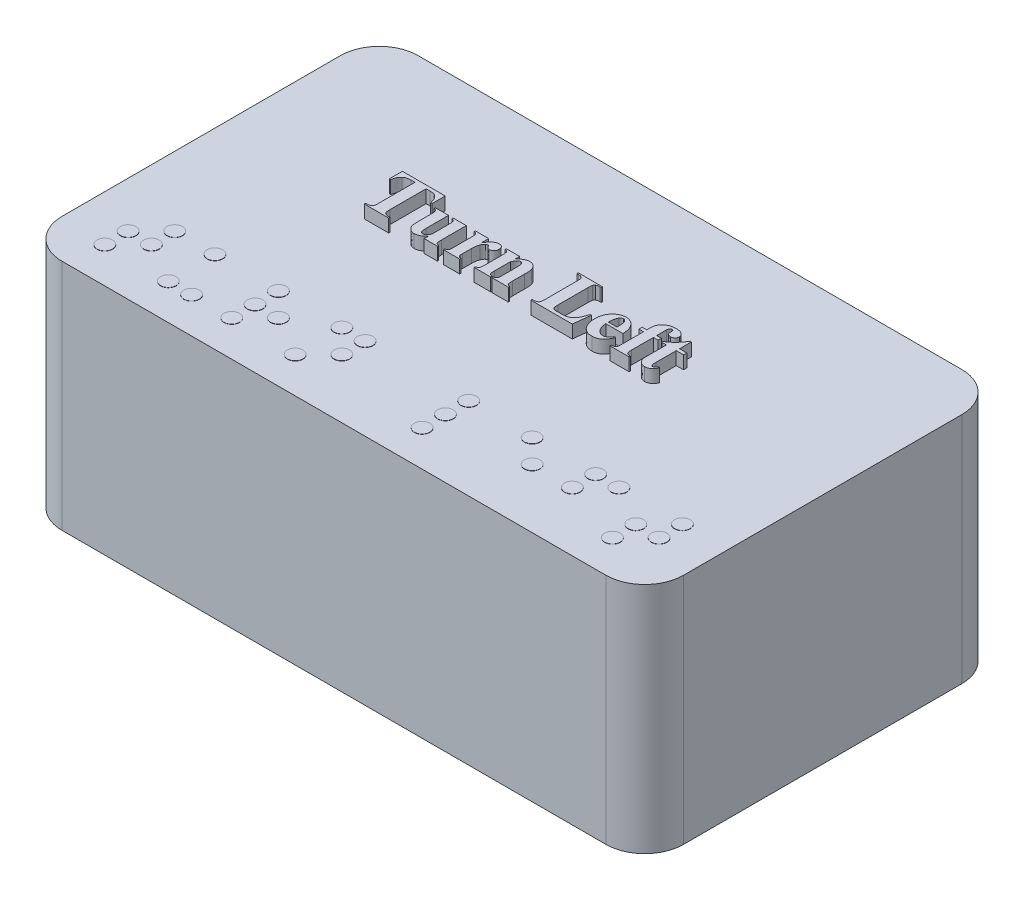
from build123d import *

# Parameters (mm, degrees)
SKETCH1_W           = 60.96
SKETCH1_H           = 34.925
BOSS_EXTRUDE1_DEPTH = 22.86
BOSS_EXTRUDE3_DEPTH = 1.27
SKETCH3_R           = 0.762
BOSS_EXTRUDE4_DEPTH = 0.0254
SKETCH6_R           = 3.1499937
CUT_EXTRUDE1_DEPTH  = 3.25
SKETCH7_W           = 41.656
SKETCH7_H           = 22.86
CUT_EXTRUDE2_DEPTH  = 17.78
FILLET2_R           = 3.81
SKETCH8_W           = 8.128
SKETCH8_H           = 8.128
BOSS_EXTRUDE5_DEPTH = 13.97


with BuildPart() as part:
    # Sketch1 → Boss-Extrude1 (new body)
    with BuildSketch(Plane(origin=(0, 0, 0), x_dir=(1, 0, 0), z_dir=(0, 1, 0))):
        Rectangle(SKETCH1_W, SKETCH1_H)
    extrude(amount=BOSS_EXTRUDE1_DEPTH)

    # Sketch2 → Boss-Extrude3 (add)
    # profile 1 of 8: a face of its own
    with BuildSketch(Plane(origin=(0, 22.86, 0), x_dir=(1, 0, 0), z_dir=(0, 1, 0))):
        with BuildLine():
            Line((-12.148455524, 5.599933811), (-12.148455524, 4.308979974))
            Line((-12.148455524, 4.308979974), (-12.277550908, 4.308979974))
            add(Edge.make_bspline(
                [(-12.277550908, 4.308979974), (-12.294909334, 4.375100646), (-12.327334265, 4.498611739), (-12.384039289, 4.667143435), (-12.443870984, 4.806085238), (-12.508893714, 4.918547094), (-12.582321069, 5.010972582), (-12.666276071, 5.090032176), (-12.761353721, 5.160732409), (-12.832360072, 5.197787672), (-12.868565711, 5.216681891)],
                knots=[0, 0, 0, 0, 1.457214957, 2.722026344, 3.787486567, 4.677495633, 5.483472642, 6.294659805, 7.130459019, 8, 8, 8, 8], degree=3))
            add(Edge.make_bspline(
                [(-12.868565711, 5.216681891), (-12.893225428, 5.226172848), (-12.949269887, 5.24774307), (-13.049194913, 5.264469029), (-13.171879924, 5.27520717), (-13.261528456, 5.276494697), (-13.310313977, 5.277195352)],
                knots=[0, 0, 0, 0, 0.705326227, 1.603004102, 2.695587181, 4, 4, 4, 4], degree=3))
            Line((-13.310313977, 5.277195352), (-13.697600128, 5.277195352))
            Line((-13.697600128, 5.277195352), (-13.697600128, 1.727072302))
            add(Edge.make_bspline(
                [(-13.697600128, 1.727072302), (-13.697226832, 1.699841593), (-13.696512494, 1.647733072), (-13.696077108, 1.573745709), (-13.693314113, 1.507779039), (-13.687664945, 1.450039153), (-13.683169809, 1.400183585), (-13.677361392, 1.357979519), (-13.669698153, 1.324185152), (-13.657604672, 1.289446465), (-13.635262948, 1.253673565), (-13.602968201, 1.21329554), (-13.559591174, 1.177424509), (-13.507918198, 1.143739926), (-13.446036958, 1.115264601), (-13.373500851, 1.095650857), (-13.291219773, 1.083571316), (-13.233037418, 1.082276985), (-13.202398305, 1.081595384)],
                knots=[0, 0, 0, 0, 1.352414483, 2.587972293, 3.674315684, 4.629596459, 5.468520019, 6.160314109, 6.743452474, 7.187055041, 7.980208969, 8.822448445, 9.745981434, 10.760137711, 11.880707985, 13.112198476, 14.47926954, 16, 16, 16, 16], degree=3))
            Line((-13.202398305, 1.081595384), (-13.05212321, 1.081595384))
            Line((-13.05212321, 1.081595384), (-13.05212321, 0.9525))
            Line((-13.05212321, 0.9525), (-15.440387807, 0.9525))
            Line((-15.440387807, 0.9525), (-15.440387807, 1.081595384))
            Line((-15.440387807, 1.081595384), (-15.289104154, 1.081595384))
            add(Edge.make_bspline(
                [(-15.289104154, 1.081595384), (-15.257447234, 1.082199155), (-15.197190258, 1.083348396), (-15.111819804, 1.096518729), (-15.035826947, 1.118092532), (-14.990972636, 1.140435659), (-14.969391368, 1.151185864)],
                knots=[0, 0, 0, 0, 1.147815573, 2.184795468, 3.126629849, 4, 4, 4, 4], degree=3))
            add(Edge.make_bspline(
                [(-14.969391368, 1.151185864), (-14.955203583, 1.15972569), (-14.926504959, 1.176999791), (-14.889761842, 1.213944816), (-14.857476321, 1.258216133), (-14.840807352, 1.292092581), (-14.832227523, 1.30952942)],
                knots=[0, 0, 0, 0, 0.928829741, 1.878808762, 2.908183361, 4, 4, 4, 4], degree=3))
            add(Edge.make_bspline(
                [(-14.832227523, 1.30952942), (-14.828933318, 1.317518018), (-14.82142925, 1.335715722), (-14.815849977, 1.368349548), (-14.807759916, 1.408072894), (-14.803677458, 1.456409779), (-14.799559108, 1.512868459), (-14.796348936, 1.577100788), (-14.796012277, 1.649415748), (-14.795292319, 1.700178431), (-14.794910889, 1.727072302)],
                knots=[0, 0, 0, 0, 0.491154816, 1.118830903, 1.878082211, 2.802823963, 3.878617243, 5.106317376, 6.466938293, 8, 8, 8, 8], degree=3))
            Line((-14.794910889, 1.727072302), (-14.794910889, 5.277195352))
            Line((-14.794910889, 5.277195352), (-15.18219704, 5.277195352))
            add(Edge.make_bspline(
                [(-15.18219704, 5.277195352), (-15.219198254, 5.276670276), (-15.290295248, 5.275661354), (-15.393066053, 5.26643222), (-15.488158706, 5.251516614), (-15.575658626, 5.230745045), (-15.655691821, 5.20360755), (-15.726954577, 5.168997403), (-15.791823427, 5.130253464), (-15.828755919, 5.098224021), (-15.846836554, 5.082543719)],
                knots=[0, 0, 0, 0, 1.253047779, 2.407702914, 3.491633713, 4.510764096, 5.450666339, 6.347071276, 7.190793839, 8, 8, 8, 8], degree=3))
            add(Edge.make_bspline(
                [(-15.846836554, 5.082543719), (-15.87056575, 5.059159202), (-15.918176171, 5.012240351), (-15.980459042, 4.932426478), (-16.037278643, 4.846702569), (-16.087064397, 4.753205046), (-16.128676551, 4.652189831), (-16.165581486, 4.54462581), (-16.194789182, 4.42957627), (-16.20813748, 4.349770553), (-16.214960109, 4.308979974)],
                knots=[0, 0, 0, 0, 0.914922114, 1.835705892, 2.776354923, 3.739610741, 4.741925865, 5.776441286, 6.863486844, 8, 8, 8, 8], degree=3))
            Line((-16.214960109, 4.308979974), (-16.344055492, 4.308979974))
            Line((-16.344055492, 4.308979974), (-16.344055492, 5.599933811))
            Line((-16.344055492, 5.599933811), (-12.148455524, 5.599933811))
        make_face()
    # profile 2 of 8: a face of its own
    with BuildSketch(Plane(origin=(0, 22.86, 0), x_dir=(1, 0, 0), z_dir=(0, 1, 0))):
        with BuildLine():
            Line((-8.598332474, 4.115336899), (-8.598332474, 1.66252461))
            add(Edge.make_bspline(
                [(-8.598332474, 1.66252461), (-8.598160985, 1.632937655), (-8.597835444, 1.576772256), (-8.594832133, 1.49671801), (-8.589930789, 1.425401432), (-8.583276921, 1.362727987), (-8.573763787, 1.30901769), (-8.564728978, 1.263396953), (-8.55176996, 1.226726811), (-8.531479616, 1.189092097), (-8.493854917, 1.152444594), (-8.435198038, 1.119122335), (-8.360822727, 1.094390643), (-8.305366165, 1.086065032), (-8.275594015, 1.081595384)],
                knots=[0, 0, 0, 0, 1.39224544, 2.642922262, 3.768920435, 4.75598894, 5.606449179, 6.335712818, 6.941226423, 7.42985547, 8.336022398, 9.364319116, 10.5850207, 12, 12, 12, 12], degree=3))
            Line((-8.275594015, 1.081595384), (-8.275594015, 0.9525))
            Line((-8.275594015, 0.9525), (-9.566547852, 0.9525))
            Line((-9.566547852, 0.9525), (-9.566547852, 1.378111343))
            add(Edge.make_bspline(
                [(-9.566547852, 1.378111343), (-9.602763506, 1.33538285), (-9.671746772, 1.253993986), (-9.782938995, 1.1479731), (-9.893321597, 1.061098065), (-10.00655917, 0.994972969), (-10.122973804, 0.947177146), (-10.243952914, 0.912367127), (-10.371706274, 0.892131106), (-10.459050903, 0.889361617), (-10.503497941, 0.887952308)],
                knots=[0, 0, 0, 0, 1.222807259, 2.32919272, 3.350089848, 4.284690576, 5.183461769, 6.092347085, 7.029253196, 8, 8, 8, 8], degree=3))
            add(Edge.make_bspline(
                [(-10.503497941, 0.887952308), (-10.546053266, 0.889798104), (-10.629927304, 0.89343606), (-10.75125744, 0.925119033), (-10.865814923, 0.9751248), (-10.969705265, 1.045559287), (-11.061617101, 1.128727462), (-11.139665189, 1.219739897), (-11.199456246, 1.318818042), (-11.237213496, 1.407482137), (-11.258348634, 1.486199214), (-11.272354878, 1.555224675), (-11.282689051, 1.634843945), (-11.293378071, 1.72384498), (-11.299427146, 1.8231941), (-11.306235065, 1.932062509), (-11.308691199, 2.051145347), (-11.309115031, 2.133857731), (-11.309335531, 2.176889029)],
                knots=[0, 0, 0, 0, 1.179300257, 2.324331327, 3.45640261, 4.633819028, 5.789896643, 6.888959454, 7.948254218, 8.989646921, 9.551011043, 10.207911897, 10.942867762, 11.77847968, 12.695167625, 13.704381698, 14.805699566, 16, 16, 16, 16], degree=3))
            Line((-11.309335531, 2.176889029), (-11.309335531, 3.405312289))
            add(Edge.make_bspline(
                [(-11.309335531, 3.405312289), (-11.309523276, 3.434897874), (-11.309879675, 3.491060674), (-11.312664672, 3.570797069), (-11.318182572, 3.64168966), (-11.323135353, 3.703807614), (-11.332591015, 3.757314946), (-11.343335517, 3.801775288), (-11.354850453, 3.838551873), (-11.375244882, 3.875425026), (-11.411981379, 3.91260458), (-11.470179895, 3.946954426), (-11.545684117, 3.971216355), (-11.601662603, 3.980952285), (-11.63207399, 3.986241515)],
                knots=[0, 0, 0, 0, 1.394039664, 2.646328268, 3.757976898, 4.744665889, 5.580609571, 6.314412226, 6.900504699, 7.389763455, 8.286108214, 9.323861881, 10.546136616, 12, 12, 12, 12], degree=3))
            Line((-11.63207399, 3.986241515), (-11.63207399, 4.115336899))
            Line((-11.63207399, 4.115336899), (-10.341120153, 4.115336899))
            Line((-10.341120153, 4.115336899), (-10.341120153, 1.920715377))
            add(Edge.make_bspline(
                [(-10.341120153, 1.920715377), (-10.340695366, 1.868607228), (-10.339927763, 1.774446275), (-10.335658417, 1.64853367), (-10.327394584, 1.552833995), (-10.315289701, 1.482993342), (-10.295714298, 1.432253383), (-10.27556868, 1.39024405), (-10.248191299, 1.355924036), (-10.210276642, 1.316471956), (-10.149656337, 1.282952231), (-10.096465027, 1.277813016), (-10.069818136, 1.275238459)],
                knots=[0, 0, 0, 0, 1.993484448, 3.602284879, 4.816664265, 5.669126267, 6.299796805, 6.892200411, 7.442637561, 7.970059267, 8.983074313, 10, 10, 10, 10], degree=3))
            add(Edge.make_bspline(
                [(-10.069818136, 1.275238459), (-10.051253597, 1.275974082), (-10.014723284, 1.277421602), (-9.961660329, 1.290101691), (-9.911338426, 1.310085112), (-9.881259526, 1.329828658), (-9.866089484, 1.339786151)],
                knots=[0, 0, 0, 0, 1.02458571, 2.01612534, 2.999449339, 4, 4, 4, 4], degree=3))
            add(Edge.make_bspline(
                [(-9.866089484, 1.339786151), (-9.843694203, 1.35770107), (-9.793556937, 1.39780796), (-9.72366423, 1.479003662), (-9.644309616, 1.5794022), (-9.593787865, 1.656996085), (-9.566547852, 1.698832687)],
                knots=[0, 0, 0, 0, 0.731142629, 1.63684001, 2.725845665, 4, 4, 4, 4], degree=3))
            Line((-9.566547852, 1.698832687), (-9.566547852, 3.405312289))
            add(Edge.make_bspline(
                [(-9.566547852, 3.405312289), (-9.566735597, 3.434897874), (-9.567091996, 3.491060674), (-9.569876993, 3.570797069), (-9.575394893, 3.64168966), (-9.580347674, 3.703807614), (-9.589803336, 3.757314946), (-9.600547838, 3.801775288), (-9.612062774, 3.838551873), (-9.632457203, 3.875425026), (-9.6691937, 3.91260458), (-9.727392216, 3.946954426), (-9.802896438, 3.971216355), (-9.858874924, 3.980952285), (-9.889286311, 3.986241515)],
                knots=[0, 0, 0, 0, 1.394039664, 2.646328268, 3.757976898, 4.744665889, 5.580609571, 6.314412226, 6.900504699, 7.389763455, 8.286108214, 9.323861881, 10.546136616, 12, 12, 12, 12], degree=3))
            Line((-9.889286311, 3.986241515), (-9.889286311, 4.115336899))
            Line((-9.889286311, 4.115336899), (-8.598332474, 4.115336899))
        make_face()
    # profile 3 of 8: a face of its own
    with BuildSketch(Plane(origin=(0, 22.86, 0), x_dir=(1, 0, 0), z_dir=(0, 1, 0))):
        with BuildLine():
            Line((-6.403710953, 4.115336899), (-6.403710953, 3.393209597))
            add(Edge.make_bspline(
                [(-6.403710953, 3.393209597), (-6.37904686, 3.432680317), (-6.331652847, 3.508526441), (-6.259777249, 3.615888561), (-6.190574733, 3.712751974), (-6.123152453, 3.79877951), (-6.057619257, 3.873312504), (-5.995277978, 3.937671461), (-5.93453637, 3.990183919), (-5.859318368, 4.04626973), (-5.764830647, 4.097524013), (-5.654202554, 4.145294764), (-5.544213824, 4.174366236), (-5.471289443, 4.178067754), (-5.435495575, 4.179884591)],
                knots=[0, 0, 0, 0, 1.28378317, 2.466891324, 3.563228772, 4.566896305, 5.480263729, 6.299947201, 7.03623121, 7.692808895, 8.884463118, 9.990134257, 11.013486747, 12, 12, 12, 12], degree=3))
            add(Edge.make_bspline(
                [(-5.435495575, 4.179884591), (-5.40278597, 4.178241932), (-5.339917819, 4.175084728), (-5.249949035, 4.153586879), (-5.172062159, 4.112641174), (-5.104048863, 4.059126892), (-5.050328836, 3.990036166), (-5.00962965, 3.90881885), (-4.98838035, 3.813816477), (-4.985284993, 3.746969536), (-4.983661733, 3.711913825)],
                knots=[0, 0, 0, 0, 1.067254018, 2.051271649, 2.987962338, 3.916142169, 4.852897039, 5.818972052, 6.856230589, 8, 8, 8, 8], degree=3))
            add(Edge.make_bspline(
                [(-4.983661733, 3.711913825), (-4.984935458, 3.674428478), (-4.987366746, 3.602876428), (-5.013228097, 3.502200368), (-5.054725305, 3.414199967), (-5.113003491, 3.341153764), (-5.182623365, 3.283261389), (-5.260989461, 3.242789405), (-5.345628011, 3.215511739), (-5.405019325, 3.212972306), (-5.435495575, 3.211669214)],
                knots=[0, 0, 0, 0, 1.186924203, 2.265601578, 3.27210748, 4.251520855, 5.206054494, 6.12203332, 7.036334129, 8, 8, 8, 8], degree=3))
            add(Edge.make_bspline(
                [(-5.435495575, 3.211669214), (-5.459633407, 3.213417703), (-5.507696065, 3.216899252), (-5.576319466, 3.245458744), (-5.640470994, 3.289634559), (-5.693391985, 3.350287368), (-5.739218646, 3.409206145), (-5.776021042, 3.457265335), (-5.803141375, 3.488448604), (-5.817712512, 3.503839371), (-5.822781726, 3.509193731)],
                knots=[0, 0, 0, 0, 1.137523, 2.265007851, 3.464261342, 4.791218154, 6.047267266, 6.998004642, 7.651411595, 8, 8, 8, 8], degree=3))
            add(Edge.make_bspline(
                [(-5.822781726, 3.509193731), (-5.832443698, 3.516674644), (-5.851499577, 3.53142892), (-5.875498671, 3.533424111), (-5.887329418, 3.534407673)],
                knots=[0, 0, 0, 0, 1.014067194, 2, 2, 2, 2], degree=3))
            add(Edge.make_bspline(
                [(-5.887329418, 3.534407673), (-5.903926355, 3.533812343), (-5.937402793, 3.532611548), (-5.986095913, 3.51684895), (-6.034654318, 3.495376787), (-6.063220521, 3.473215823), (-6.07794682, 3.461791519)],
                knots=[0, 0, 0, 0, 0.953349183, 1.922929249, 2.929239392, 4, 4, 4, 4], degree=3))
            add(Edge.make_bspline(
                [(-6.07794682, 3.461791519), (-6.10084673, 3.441631402), (-6.147523417, 3.400539212), (-6.205426791, 3.324558486), (-6.256224566, 3.237793559), (-6.280283718, 3.173452472), (-6.292769607, 3.140061618)],
                knots=[0, 0, 0, 0, 0.932256387, 1.900210064, 2.910279825, 4, 4, 4, 4], degree=3))
            add(Edge.make_bspline(
                [(-6.292769607, 3.140061618), (-6.309975765, 3.085204064), (-6.344737206, 2.974375857), (-6.377780885, 2.800199405), (-6.399962675, 2.618543034), (-6.402446041, 2.494319335), (-6.403710953, 2.431045566)],
                knots=[0, 0, 0, 0, 0.956536251, 1.93248131, 2.946902223, 4, 4, 4, 4], degree=3))
            Line((-6.403710953, 2.431045566), (-6.403710953, 1.71900384))
            Line((-6.403710953, 1.71900384), (-6.403710953, 1.533429226))
            add(Edge.make_bspline(
                [(-6.403710953, 1.533429226), (-6.403783748, 1.502814712), (-6.403914225, 1.447941838), (-6.398812605, 1.37476914), (-6.395964412, 1.319099294), (-6.388565814, 1.288635991), (-6.385556914, 1.276247017)],
                knots=[0, 0, 0, 0, 1.420860174, 2.546722794, 3.408973677, 4, 4, 4, 4], degree=3))
            add(Edge.make_bspline(
                [(-6.385556914, 1.276247017), (-6.379850236, 1.261305807), (-6.368931794, 1.232719168), (-6.347663767, 1.19373716), (-6.322512373, 1.160987427), (-6.29204608, 1.134142536), (-6.253031616, 1.114780801), (-6.205357561, 1.098554475), (-6.146466053, 1.088561327), (-6.103854744, 1.084029157), (-6.080972493, 1.081595384)],
                knots=[0, 0, 0, 0, 0.98092767, 1.876784157, 2.714685899, 3.504727118, 4.34465891, 5.369109996, 6.5872134, 8, 8, 8, 8], degree=3))
            Line((-6.080972493, 1.081595384), (-6.080972493, 0.9525))
            Line((-6.080972493, 0.9525), (-7.694664789, 0.9525))
            Line((-7.694664789, 0.9525), (-7.694664789, 1.081595384))
            add(Edge.make_bspline(
                [(-7.694664789, 1.081595384), (-7.665668574, 1.085277206), (-7.611669015, 1.092133851), (-7.537839635, 1.111620031), (-7.480297705, 1.144080196), (-7.441542377, 1.178806333), (-7.421702885, 1.216868197), (-7.4073663, 1.253161754), (-7.397413068, 1.299241263), (-7.386598037, 1.353867487), (-7.380512163, 1.418034385), (-7.375317665, 1.491329777), (-7.372453697, 1.57375055), (-7.372108077, 1.631930244), (-7.37192633, 1.66252461)],
                knots=[0, 0, 0, 0, 1.368345457, 2.548265428, 3.541518543, 4.442662975, 4.928583759, 5.536264819, 6.265061099, 7.1290476, 8.141917245, 9.277368428, 10.56827733, 12, 12, 12, 12], degree=3))
            Line((-7.37192633, 1.66252461), (-7.37192633, 3.405312289))
            add(Edge.make_bspline(
                [(-7.37192633, 3.405312289), (-7.372419106, 3.449026944), (-7.373306347, 3.527735038), (-7.376833634, 3.633004292), (-7.382968978, 3.712565567), (-7.393084309, 3.756014175), (-7.397140272, 3.773435844)],
                knots=[0, 0, 0, 0, 1.418425574, 2.553870665, 3.420142823, 4, 4, 4, 4], degree=3))
            add(Edge.make_bspline(
                [(-7.397140272, 3.773435844), (-7.402490459, 3.789376943), (-7.412627914, 3.8195819), (-7.4327581, 3.860638235), (-7.457049733, 3.894717362), (-7.486978622, 3.922329808), (-7.523707021, 3.945238262), (-7.570824839, 3.963428912), (-7.629004646, 3.976510092), (-7.671756179, 3.982846253), (-7.694664789, 3.986241515)],
                knots=[0, 0, 0, 0, 1.019812747, 1.932326075, 2.764916358, 3.544568088, 4.388087827, 5.377018227, 6.594462856, 8, 8, 8, 8], degree=3))
            Line((-7.694664789, 3.986241515), (-7.694664789, 4.115336899))
            Line((-7.694664789, 4.115336899), (-6.403710953, 4.115336899))
        make_face()
    # profile 4 of 8: a face of its own
    with BuildSketch(Plane(origin=(0, 22.86, 0), x_dir=(1, 0, 0), z_dir=(0, 1, 0))):
        with BuildLine():
            Line((-3.369969437, 4.115336899), (-3.369969437, 3.663503056))
            add(Edge.make_bspline(
                [(-3.369969437, 3.663503056), (-3.331167147, 3.706029813), (-3.256931294, 3.787391251), (-3.142041506, 3.896198305), (-3.028711021, 3.985249739), (-2.917504253, 4.058424963), (-2.803706786, 4.111839716), (-2.687891463, 4.152852429), (-2.566962459, 4.174628889), (-2.485202667, 4.178126721), (-2.444113483, 4.179884591)],
                knots=[0, 0, 0, 0, 1.260881314, 2.412295797, 3.461249415, 4.415243288, 5.321092959, 6.208402406, 7.099615082, 8, 8, 8, 8], degree=3))
            add(Edge.make_bspline(
                [(-2.444113483, 4.179884591), (-2.395853334, 4.178185653), (-2.302600056, 4.174902787), (-2.169281674, 4.14286547), (-2.048714173, 4.089860886), (-1.94312222, 4.015554187), (-1.852481068, 3.92649646), (-1.776719691, 3.826456468), (-1.717021702, 3.715977671), (-1.692140133, 3.636101042), (-1.679626758, 3.595929691)],
                knots=[0, 0, 0, 0, 1.113417533, 2.151461132, 3.145931688, 4.139218585, 5.116894973, 6.070708287, 7.029725548, 8, 8, 8, 8], degree=3))
            add(Edge.make_bspline(
                [(-1.679626758, 3.595929691), (-1.675407577, 3.578487616), (-1.666132248, 3.540143447), (-1.655348685, 3.476496539), (-1.646492978, 3.40210302), (-1.63980053, 3.316617472), (-1.633592999, 3.220477706), (-1.629709038, 3.11319566), (-1.627980883, 2.995171329), (-1.627455979, 2.912800394), (-1.627181758, 2.869768158)],
                knots=[0, 0, 0, 0, 0.590143294, 1.297354507, 2.12169699, 3.053812051, 4.117478097, 5.290489801, 6.584497285, 8, 8, 8, 8], degree=3))
            Line((-1.627181758, 2.869768158), (-1.627181758, 1.66252461))
            add(Edge.make_bspline(
                [(-1.627181758, 1.66252461), (-1.627008276, 1.632936656), (-1.626676983, 1.576433392), (-1.62368397, 1.496391581), (-1.618957474, 1.425024465), (-1.611372732, 1.362589011), (-1.60473732, 1.308297201), (-1.592703175, 1.263506644), (-1.581930596, 1.22649823), (-1.561195591, 1.189450469), (-1.524694392, 1.151717289), (-1.465357913, 1.119759222), (-1.390874689, 1.093835169), (-1.334943687, 1.085914627), (-1.304443299, 1.081595384)],
                knots=[0, 0, 0, 0, 1.390497233, 2.655392461, 3.764216251, 4.75004532, 5.612562094, 6.329161699, 6.928732761, 7.416748249, 8.310815283, 9.351464093, 10.555695935, 12, 12, 12, 12], degree=3))
            Line((-1.304443299, 1.081595384), (-1.304443299, 0.9525))
            Line((-1.304443299, 0.9525), (-2.918135594, 0.9525))
            Line((-2.918135594, 0.9525), (-2.918135594, 1.081595384))
            add(Edge.make_bspline(
                [(-2.918135594, 1.081595384), (-2.888825054, 1.086286025), (-2.833230539, 1.095182959), (-2.759037375, 1.12929459), (-2.695468634, 1.173116755), (-2.666330938, 1.213736853), (-2.651876366, 1.233887594)],
                knots=[0, 0, 0, 0, 1.118195018, 2.120926746, 3.06783291, 4, 4, 4, 4], degree=3))
            add(Edge.make_bspline(
                [(-2.651876366, 1.233887594), (-2.647278899, 1.242185209), (-2.636798687, 1.261100139), (-2.625322321, 1.295134792), (-2.616893409, 1.337237386), (-2.608497612, 1.386629147), (-2.60317962, 1.444286112), (-2.597450441, 1.50979108), (-2.596322979, 1.583521725), (-2.595716226, 1.635296357), (-2.595397135, 1.66252461)],
                knots=[0, 0, 0, 0, 0.521333437, 1.188412033, 1.965031516, 2.88360476, 3.944012811, 5.150158571, 6.501269856, 8, 8, 8, 8], degree=3))
            Line((-2.595397135, 1.66252461), (-2.595397135, 3.039205849))
            add(Edge.make_bspline(
                [(-2.595397135, 3.039205849), (-2.595188387, 3.06946527), (-2.594789388, 3.127302585), (-2.597469209, 3.209314942), (-2.599041601, 3.282631358), (-2.602087862, 3.346852081), (-2.605837262, 3.40272092), (-2.611227247, 3.449368383), (-2.615310967, 3.487704603), (-2.625097929, 3.525785799), (-2.637894426, 3.566337723), (-2.660610585, 3.607720682), (-2.687125273, 3.644094557), (-2.727932403, 3.68310483), (-2.787562288, 3.721005184), (-2.841896416, 3.725722323), (-2.868716268, 3.728050748)],
                knots=[0, 0, 0, 0, 1.535051339, 2.934069612, 4.162584373, 5.255375038, 6.195939586, 7.002100949, 7.638913747, 8.147746898, 8.994562512, 9.788176559, 10.531831476, 11.267620969, 12.651271267, 14, 14, 14, 14], degree=3))
            add(Edge.make_bspline(
                [(-2.868716268, 3.728050748), (-2.891119242, 3.726451986), (-2.936870793, 3.723186981), (-3.003874657, 3.696874102), (-3.069093648, 3.655446522), (-3.132917481, 3.598028613), (-3.19416698, 3.523773539), (-3.255741676, 3.434998847), (-3.314985461, 3.329284427), (-3.350990618, 3.252266456), (-3.369969437, 3.211669214)],
                knots=[0, 0, 0, 0, 0.709315427, 1.448570177, 2.25378778, 3.153099622, 4.159904318, 5.302296704, 6.578003089, 8, 8, 8, 8], degree=3))
            Line((-3.369969437, 3.211669214), (-3.369969437, 1.66252461))
            add(Edge.make_bspline(
                [(-3.369969437, 1.66252461), (-3.369756977, 1.633613418), (-3.369354158, 1.578798737), (-3.36686865, 1.500354727), (-3.360187075, 1.4305031), (-3.354148233, 1.368348445), (-3.343603679, 1.315321593), (-3.333060072, 1.269810854), (-3.319443443, 1.232698729), (-3.297754342, 1.194017282), (-3.259780769, 1.155835429), (-3.202166167, 1.120352259), (-3.129377823, 1.095590108), (-3.075978852, 1.086492937), (-3.047230978, 1.081595384)],
                knots=[0, 0, 0, 0, 1.371913262, 2.601103045, 3.721795428, 4.701216673, 5.561557843, 6.285020286, 6.916059018, 7.430476257, 8.378209682, 9.431606224, 10.617279377, 12, 12, 12, 12], degree=3))
            Line((-3.047230978, 1.081595384), (-3.047230978, 0.9525))
            Line((-3.047230978, 0.9525), (-4.660923274, 0.9525))
            Line((-4.660923274, 0.9525), (-4.660923274, 1.081595384))
            add(Edge.make_bspline(
                [(-4.660923274, 1.081595384), (-4.631411511, 1.085895555), (-4.575932998, 1.093979351), (-4.500748403, 1.121837619), (-4.437413076, 1.159550437), (-4.407292057, 1.195317563), (-4.392646929, 1.212707883)],
                knots=[0, 0, 0, 0, 1.161939667, 2.184304822, 3.117191614, 4, 4, 4, 4], degree=3))
            add(Edge.make_bspline(
                [(-4.392646929, 1.212707883), (-4.387999915, 1.220646383), (-4.377591892, 1.238426425), (-4.366958145, 1.272029214), (-4.358529579, 1.314679706), (-4.35004441, 1.366426318), (-4.346346067, 1.427542795), (-4.34006432, 1.497345654), (-4.339158197, 1.576801995), (-4.3385207, 1.632944248), (-4.338184814, 1.66252461)],
                knots=[0, 0, 0, 0, 0.481900215, 1.079322925, 1.837685983, 2.766571147, 3.829570474, 5.050991329, 6.446219399, 8, 8, 8, 8], degree=3))
            Line((-4.338184814, 1.66252461), (-4.338184814, 3.405312289))
            add(Edge.make_bspline(
                [(-4.338184814, 3.405312289), (-4.33837256, 3.434897874), (-4.338728959, 3.491060674), (-4.341513956, 3.570797069), (-4.347031856, 3.64168966), (-4.351984637, 3.703807614), (-4.361440299, 3.757314946), (-4.372184801, 3.801775288), (-4.383699737, 3.838551873), (-4.404094166, 3.875425026), (-4.440830663, 3.91260458), (-4.499029179, 3.946954426), (-4.574533401, 3.971216355), (-4.630511887, 3.980952285), (-4.660923274, 3.986241515)],
                knots=[0, 0, 0, 0, 1.394039664, 2.646328268, 3.757976898, 4.744665889, 5.580609571, 6.314412226, 6.900504699, 7.389763455, 8.286108214, 9.323861881, 10.546136616, 12, 12, 12, 12], degree=3))
            Line((-4.660923274, 3.986241515), (-4.660923274, 4.115336899))
            Line((-4.660923274, 4.115336899), (-3.369969437, 4.115336899))
        make_face()
    # profile 5 of 8: a face of its own
    with BuildSketch(Plane(origin=(0, 22.86, 0), x_dir=(1, 0, 0), z_dir=(0, 1, 0))):
        with BuildLine():
            Line((5.150325883, 2.630739987), (4.956682807, 0.9525))
            Line((4.956682807, 0.9525), (0.890178223, 0.9525))
            Line((0.890178223, 0.9525), (0.890178223, 1.081595384))
            Line((0.890178223, 1.081595384), (1.042470433, 1.081595384))
            add(Edge.make_bspline(
                [(1.042470433, 1.081595384), (1.074130952, 1.08218679), (1.13439478, 1.083312496), (1.220038346, 1.096691359), (1.29648633, 1.117879406), (1.341616734, 1.140413307), (1.363191777, 1.151185864)],
                knots=[0, 0, 0, 0, 1.144467932, 2.17842344, 3.129177061, 4, 4, 4, 4], degree=3))
            add(Edge.make_bspline(
                [(1.363191777, 1.151185864), (1.377365764, 1.159736334), (1.406036477, 1.177031966), (1.442858579, 1.213668809), (1.474062482, 1.258328669), (1.490082013, 1.292115586), (1.498338506, 1.30952942)],
                knots=[0, 0, 0, 0, 0.93343552, 1.888125192, 2.911536119, 4, 4, 4, 4], degree=3))
            add(Edge.make_bspline(
                [(1.498338506, 1.30952942), (1.501632712, 1.317518018), (1.509136779, 1.335715722), (1.514716052, 1.368349548), (1.522806114, 1.408072894), (1.526888571, 1.456409779), (1.531006921, 1.512868459), (1.534217094, 1.577100788), (1.534553753, 1.649415748), (1.53527371, 1.700178431), (1.535655141, 1.727072302)],
                knots=[0, 0, 0, 0, 0.491154816, 1.118830903, 1.878082211, 2.802823963, 3.878617243, 5.106317376, 6.466938293, 8, 8, 8, 8], degree=3))
            Line((1.535655141, 1.727072302), (1.535655141, 4.825361509))
            add(Edge.make_bspline(
                [(1.535655141, 4.825361509), (1.53526921, 4.852591386), (1.534530694, 4.904698316), (1.534258045, 4.978696389), (1.530980906, 5.0446027), (1.526948562, 5.102087413), (1.522547077, 5.152036158), (1.514965483, 5.193553041), (1.508944039, 5.227713807), (1.496252463, 5.261920919), (1.476039339, 5.299302245), (1.441785502, 5.338702731), (1.398781262, 5.375100833), (1.346942295, 5.408663758), (1.285113791, 5.437186086), (1.212877816, 5.456658144), (1.13097014, 5.468941062), (1.073113332, 5.470181467), (1.042470433, 5.470838427)],
                knots=[0, 0, 0, 0, 1.353963977, 2.590937397, 3.678525439, 4.633585292, 5.456840327, 6.168525469, 6.732370981, 7.176481794, 7.976852204, 8.830756602, 9.755347706, 10.770665926, 11.892520065, 13.125421506, 14.477527201, 16, 16, 16, 16], degree=3))
            Line((1.042470433, 5.470838427), (0.890178223, 5.470838427))
            Line((0.890178223, 5.470838427), (0.890178223, 5.599933811))
            Line((0.890178223, 5.599933811), (3.27844282, 5.599933811))
            Line((3.27844282, 5.599933811), (3.27844282, 5.470838427))
            Line((3.27844282, 5.470838427), (3.093876764, 5.470838427))
            add(Edge.make_bspline(
                [(3.093876764, 5.470838427), (3.064571835, 5.470207405), (3.008327261, 5.468996291), (2.928612752, 5.455955806), (2.857569841, 5.434357269), (2.816230612, 5.411999092), (2.796352247, 5.401247947)],
                knots=[0, 0, 0, 0, 1.136010544, 2.180330518, 3.124994412, 4, 4, 4, 4], degree=3))
            add(Edge.make_bspline(
                [(2.796352247, 5.401247947), (2.783204246, 5.392638857), (2.756293358, 5.37501806), (2.72166506, 5.338398888), (2.691610044, 5.293837691), (2.675567727, 5.260286093), (2.667256863, 5.24290439)],
                knots=[0, 0, 0, 0, 0.905549368, 1.853448153, 2.887959794, 4, 4, 4, 4], degree=3))
            add(Edge.make_bspline(
                [(2.667256863, 5.24290439), (2.664400656, 5.234884349), (2.657956384, 5.216789255), (2.651295873, 5.184608035), (2.645146094, 5.144586346), (2.641960596, 5.095988968), (2.637575849, 5.039900851), (2.634384296, 4.975670537), (2.634077973, 4.903353892), (2.633349372, 4.852255281), (2.632965902, 4.825361509)],
                knots=[0, 0, 0, 0, 0.48543088, 1.095245876, 1.871366212, 2.795599073, 3.872883836, 5.083119098, 6.464812849, 8, 8, 8, 8], degree=3))
            Line((2.632965902, 4.825361509), (2.632965902, 1.898527108))
            add(Edge.make_bspline(
                [(2.632965902, 1.898527108), (2.633225445, 1.870622844), (2.633722706, 1.817160697), (2.635629613, 1.741165556), (2.638784554, 1.672919592), (2.642187857, 1.612969661), (2.648511528, 1.560859713), (2.655417732, 1.516775828), (2.662776448, 1.480047232), (2.676271451, 1.442606059), (2.698051247, 1.402919649), (2.734151802, 1.362771289), (2.780943713, 1.330374662), (2.816241367, 1.314031351), (2.834677439, 1.30549519)],
                knots=[0, 0, 0, 0, 1.490635115, 2.855927462, 4.060329446, 5.140210564, 6.062392905, 6.862488708, 7.524752773, 8.058687133, 8.983139787, 9.924188279, 10.915797254, 12, 12, 12, 12], degree=3))
            add(Edge.make_bspline(
                [(2.834677439, 1.30549519), (2.854097959, 1.300665817), (2.902095686, 1.288730046), (2.991284942, 1.282369085), (3.10989575, 1.275796394), (3.199414007, 1.275437846), (3.249194647, 1.275238459)],
                knots=[0, 0, 0, 0, 0.575584265, 1.422553843, 2.566695514, 4, 4, 4, 4], degree=3))
            Line((3.249194647, 1.275238459), (3.636480798, 1.275238459))
            add(Edge.make_bspline(
                [(3.636480798, 1.275238459), (3.695747784, 1.276624753), (3.809773117, 1.279291882), (3.972734933, 1.304022285), (4.121061764, 1.342307665), (4.254506075, 1.399807936), (4.376053321, 1.475044046), (4.487409082, 1.569080052), (4.590658463, 1.68085724), (4.668535215, 1.788219695), (4.72634004, 1.885154219), (4.771167012, 1.966893604), (4.81376219, 2.05795767), (4.857513588, 2.156077597), (4.898313644, 2.263327481), (4.941235528, 2.377880866), (4.98206114, 2.501505647), (5.007967275, 2.58697966), (5.021230499, 2.630739987)],
                knots=[0, 0, 0, 0, 1.339079776, 2.576291275, 3.717540107, 4.793388576, 5.848005655, 6.937937627, 8.078122971, 9.28066993, 9.928503433, 10.629116776, 11.387232161, 12.20063414, 13.057376066, 13.980773734, 14.966212066, 16, 16, 16, 16], degree=3))
            Line((5.021230499, 2.630739987), (5.150325883, 2.630739987))
        make_face()
    # profile 6 of 8: a face of its own
    with BuildSketch(Plane(origin=(0, 22.86, 0), x_dir=(1, 0, 0), z_dir=(0, 1, 0))):
        with BuildLine():
            Line((8.24861509, 2.630739987), (6.570375102, 2.630739987))
            add(Edge.make_bspline(
                [(6.570375102, 2.630739987), (6.573343928, 2.584271031), (6.579154629, 2.493320195), (6.600003705, 2.36097014), (6.627523954, 2.236054465), (6.664462644, 2.118841536), (6.708255698, 2.008853576), (6.761348665, 1.906493886), (6.821141246, 1.810546727), (6.869213687, 1.753444395), (6.893113562, 1.725055186)],
                knots=[0, 0, 0, 0, 1.13998881, 2.23123012, 3.278037691, 4.270341, 5.238291293, 6.173751205, 7.092055327, 8, 8, 8, 8], degree=3))
            add(Edge.make_bspline(
                [(6.893113562, 1.725055186), (6.911806512, 1.704400101), (6.948286153, 1.664091319), (7.010041661, 1.612763417), (7.073063611, 1.56751239), (7.140467918, 1.532737979), (7.209615228, 1.503452585), (7.282231281, 1.483809568), (7.357610641, 1.471074072), (7.408769912, 1.469619196), (7.434709038, 1.468881535)],
                knots=[0, 0, 0, 0, 1.079359701, 2.106390533, 3.108609383, 4.082945109, 5.042060715, 6.016658277, 6.994392403, 8, 8, 8, 8], degree=3))
            add(Edge.make_bspline(
                [(7.434709038, 1.468881535), (7.466783673, 1.470147707), (7.529976666, 1.472642301), (7.621927035, 1.495263599), (7.709960109, 1.529108125), (7.794049033, 1.580922122), (7.87725622, 1.650693241), (7.961981525, 1.741549682), (8.047980891, 1.855304959), (8.103262886, 1.940176052), (8.132630956, 1.985263069)],
                knots=[0, 0, 0, 0, 0.843397832, 1.661650544, 2.480430003, 3.318606661, 4.249316343, 5.332857738, 6.583104301, 8, 8, 8, 8], degree=3))
            Line((8.132630956, 1.985263069), (8.24861509, 1.920715377))
            add(Edge.make_bspline(
                [(8.24861509, 1.920715377), (8.227131816, 1.875150013), (8.18550769, 1.786866519), (8.118798442, 1.661174178), (8.050053601, 1.546342514), (7.980880609, 1.440456326), (7.908010247, 1.346036907), (7.834517563, 1.260573132), (7.759072185, 1.185916842), (7.681606223, 1.121195992), (7.6012132, 1.067018846), (7.519046893, 1.018666822), (7.433369768, 0.978908901), (7.345056216, 0.944704232), (7.252975792, 0.919990261), (7.157923688, 0.901802242), (7.059798153, 0.890420995), (6.993327133, 0.888781997), (6.959678369, 0.887952308)],
                knots=[0, 0, 0, 0, 1.373250216, 2.660690388, 3.877280985, 5.021168745, 6.106383051, 7.126358007, 8.092014255, 8.99677224, 9.873809633, 10.732113956, 11.593105449, 12.44591154, 13.3108453, 14.188026348, 15.082748013, 16, 16, 16, 16], degree=3))
            add(Edge.make_bspline(
                [(6.959678369, 0.887952308), (6.902757431, 0.889317385), (6.791686368, 0.891981089), (6.630713898, 0.918050073), (6.479985615, 0.958695152), (6.340608168, 1.018097563), (6.21147605, 1.092860916), (6.093399519, 1.185015785), (5.985047478, 1.293208583), (5.924472478, 1.376869343), (5.893632896, 1.419462208)],
                knots=[0, 0, 0, 0, 1.097635393, 2.141839833, 3.138170034, 4.103343773, 5.056935533, 6.009445311, 6.986580709, 8, 8, 8, 8], degree=3))
            add(Edge.make_bspline(
                [(5.893632896, 1.419462208), (5.869987561, 1.455652966), (5.822472321, 1.528378203), (5.765051103, 1.646545061), (5.713935547, 1.7698596), (5.672529421, 1.900048265), (5.641987316, 2.036884306), (5.618071737, 2.17953995), (5.605533636, 2.328957437), (5.603297933, 2.430689634), (5.602159725, 2.482482008)],
                knots=[0, 0, 0, 0, 0.92642438, 1.86164744, 2.812420939, 3.788508213, 4.787344775, 5.817549918, 6.888903665, 8, 8, 8, 8], degree=3))
            add(Edge.make_bspline(
                [(5.602159725, 2.482482008), (5.603519416, 2.545741197), (5.606173677, 2.669229876), (5.626720025, 2.849345703), (5.659685605, 3.019455556), (5.706033694, 3.180038864), (5.766380855, 3.330496109), (5.840790973, 3.470873786), (5.927628537, 3.601574685), (6.027355871, 3.72131918), (6.136797992, 3.827927349), (6.250608859, 3.92257517), (6.369622972, 4.001962546), (6.493280788, 4.06704416), (6.621866729, 4.117536409), (6.754930805, 4.15436107), (6.892746637, 4.175836931), (6.986163615, 4.178527097), (7.03330308, 4.179884591)],
                knots=[0, 0, 0, 0, 1.225001975, 2.391334415, 3.506163357, 4.57768866, 5.623603609, 6.640162622, 7.649690305, 8.657641799, 9.652212063, 10.605156454, 11.520774585, 12.417844321, 13.306580525, 14.191204402, 15.087257386, 16, 16, 16, 16], degree=3))
            add(Edge.make_bspline(
                [(7.03330308, 4.179884591), (7.072696638, 4.178701511), (7.150898185, 4.176352938), (7.266153426, 4.158195176), (7.376709044, 4.126126314), (7.483964783, 4.083811759), (7.586412642, 4.027965111), (7.685533852, 3.960578274), (7.780150896, 3.880820003), (7.869907522, 3.788596051), (7.953928931, 3.685656314), (8.026554664, 3.568957139), (8.090365434, 3.441921663), (8.142811718, 3.302188758), (8.184692988, 3.150892919), (8.216755638, 2.987705729), (8.2390648, 2.813147989), (8.245373066, 2.692661786), (8.24861509, 2.630739987)],
                knots=[0, 0, 0, 0, 0.861628449, 1.710449157, 2.543900377, 3.375629957, 4.227916616, 5.090799712, 5.993869516, 6.930025392, 7.902902669, 8.894558096, 9.930628827, 11.008359431, 12.15399121, 13.361257148, 14.64386379, 16, 16, 16, 16], degree=3))
        make_face()
        with BuildLine():
            add(Edge.make_bspline(
                [(7.409495096, 2.888930754), (7.409166197, 2.929270714), (7.408535768, 3.006593797), (7.40751256, 3.117947336), (7.401223056, 3.219386972), (7.397658633, 3.31101562), (7.388785157, 3.392299484), (7.380194842, 3.464036278), (7.369701863, 3.526149852), (7.352141208, 3.593748068), (7.327343223, 3.667354196), (7.289545893, 3.744963781), (7.243655837, 3.811900971), (7.20608416, 3.847642576), (7.187612405, 3.865214593)],
                knots=[0, 0, 0, 0, 1.409542734, 2.701792255, 3.889568995, 4.960047338, 5.904396493, 6.745020346, 7.484631612, 8.102821371, 9.183752412, 10.192317752, 11.111270354, 12, 12, 12, 12], degree=3))
            add(Edge.make_bspline(
                [(7.187612405, 3.865214593), (7.176210308, 3.874235118), (7.153286556, 3.892370752), (7.110988919, 3.908872685), (7.064565082, 3.920743766), (7.031375005, 3.921369105), (7.014140484, 3.921693824)],
                knots=[0, 0, 0, 0, 0.930688698, 1.871136194, 2.894550699, 4, 4, 4, 4], degree=3))
            add(Edge.make_bspline(
                [(7.014140484, 3.921693824), (6.988273726, 3.919810302), (6.937461241, 3.916110324), (6.865375945, 3.884286846), (6.801652678, 3.832526191), (6.76901291, 3.786467998), (6.751915486, 3.762341709)],
                knots=[0, 0, 0, 0, 0.964674528, 1.895000191, 2.897355062, 4, 4, 4, 4], degree=3))
            add(Edge.make_bspline(
                [(6.751915486, 3.762341709), (6.737335187, 3.738388715), (6.70749579, 3.689367573), (6.670685328, 3.609493573), (6.639292166, 3.523480375), (6.614352453, 3.430919269), (6.594113282, 3.33227914), (6.580137425, 3.226800166), (6.572288282, 3.114968564), (6.571023448, 3.038209623), (6.570375102, 2.998863542)],
                knots=[0, 0, 0, 0, 0.845465006, 1.730291383, 2.647993222, 3.605202892, 4.619704111, 5.684089326, 6.812880844, 8, 8, 8, 8], degree=3))
            Line((6.570375102, 2.998863542), (6.570375102, 2.888930754))
            Line((6.570375102, 2.888930754), (7.409495096, 2.888930754))
        make_face(mode=Mode.SUBTRACT)
    # profile 7 of 8: a face of its own
    with BuildSketch(Plane(origin=(0, 22.86, 0), x_dir=(1, 0, 0), z_dir=(0, 1, 0))):
        with BuildLine():
            Line((10.073095941, 3.79259844), (10.073095941, 1.66252461))
            add(Edge.make_bspline(
                [(10.073095941, 1.66252461), (10.07326156, 1.633945249), (10.073575367, 1.579794447), (10.076650063, 1.502439511), (10.081400852, 1.433442845), (10.088387342, 1.372870567), (10.096957359, 1.320416968), (10.10924952, 1.276826134), (10.121488936, 1.240359235), (10.133303395, 1.220630963), (10.138652191, 1.211699325)],
                knots=[0, 0, 0, 0, 1.490444871, 2.824023478, 4.037002488, 5.096143707, 6.004165611, 6.803813151, 7.458446801, 8, 8, 8, 8], degree=3))
            add(Edge.make_bspline(
                [(10.138652191, 1.211699325), (10.158583329, 1.189550915), (10.199963625, 1.1435672), (10.291761396, 1.104052284), (10.401248072, 1.080508133), (10.48138636, 1.081212606), (10.524929784, 1.081595384)],
                knots=[0, 0, 0, 0, 0.835978477, 1.73562783, 2.769645338, 4, 4, 4, 4], degree=3))
            Line((10.524929784, 1.081595384), (10.524929784, 0.9525))
            Line((10.524929784, 0.9525), (8.653046721, 0.9525))
            Line((8.653046721, 0.9525), (8.653046721, 1.081595384))
            add(Edge.make_bspline(
                [(8.653046721, 1.081595384), (8.685369328, 1.082693778), (8.745510429, 1.084737508), (8.827787316, 1.095904623), (8.895942158, 1.110513565), (8.949410655, 1.134362888), (8.991204831, 1.164136022), (9.026328448, 1.197062939), (9.052581545, 1.236789298), (9.075066447, 1.283445548), (9.087837378, 1.346393132), (9.098963637, 1.429495119), (9.103828493, 1.537761446), (9.104506399, 1.618153114), (9.104880564, 1.66252461)],
                knots=[0, 0, 0, 0, 1.319893084, 2.455860813, 3.388307301, 4.156466855, 4.826864367, 5.477424492, 6.109613876, 6.760753307, 7.579980325, 8.715948055, 10.187395543, 12, 12, 12, 12], degree=3))
            Line((9.104880564, 1.66252461), (9.104880564, 3.79259844))
            Line((9.104880564, 3.79259844), (8.653046721, 3.79259844))
            Line((8.653046721, 3.79259844), (8.653046721, 4.115336899))
            Line((8.653046721, 4.115336899), (9.104880564, 4.115336899))
            Line((9.104880564, 4.115336899), (9.104880564, 4.351339397))
            Line((9.104880564, 4.351339397), (9.104880564, 4.512708627))
            add(Edge.make_bspline(
                [(9.104880564, 4.512708627), (9.106077316, 4.553113174), (9.108431973, 4.632610699), (9.125970517, 4.748886372), (9.154208742, 4.860237616), (9.194543625, 4.966153553), (9.246913395, 5.066877961), (9.309099374, 5.163309904), (9.384866196, 5.253064889), (9.470001496, 5.337885951), (9.566057433, 5.414062239), (9.669864168, 5.482313823), (9.782860389, 5.538592932), (9.903232142, 5.585514592), (10.032287086, 5.620022092), (10.168651823, 5.646747874), (10.313472316, 5.661667684), (10.412611359, 5.663528213), (10.463407765, 5.664481503)],
                knots=[0, 0, 0, 0, 0.969988513, 1.908490318, 2.817033872, 3.724141561, 4.62320227, 5.539033724, 6.473464068, 7.438231123, 8.420405689, 9.412385573, 10.416089812, 11.446073475, 12.509586838, 13.619491168, 14.780285853, 16, 16, 16, 16], degree=3))
            add(Edge.make_bspline(
                [(10.463407765, 5.664481503), (10.498054173, 5.663886739), (10.564755517, 5.6627417), (10.661387635, 5.654390337), (10.751186843, 5.641934275), (10.834115078, 5.622673131), (10.910292939, 5.598294769), (10.980176758, 5.569862995), (11.042349298, 5.533793765), (11.113995427, 5.481538857), (11.188559431, 5.410074221), (11.255417623, 5.316014906), (11.296721603, 5.215181307), (11.301948502, 5.145430732), (11.304544874, 5.110783334)],
                knots=[0, 0, 0, 0, 1.115317077, 2.147210973, 3.120745261, 4.031805134, 4.884135296, 5.694253784, 6.455463018, 7.19155631, 8.546426326, 9.759457078, 10.887048837, 12, 12, 12, 12], degree=3))
            add(Edge.make_bspline(
                [(11.304544874, 5.110783334), (11.302966372, 5.083719199), (11.299847683, 5.030247873), (11.275582511, 4.952784642), (11.235424005, 4.881081752), (11.179967692, 4.816854022), (11.111587044, 4.763369999), (11.031706267, 4.724100978), (10.941432068, 4.700646175), (10.87773248, 4.697763555), (10.84464257, 4.696266125)],
                knots=[0, 0, 0, 0, 0.939341334, 1.855881507, 2.792093271, 3.778016848, 4.785307551, 5.788524536, 6.851208853, 8, 8, 8, 8], degree=3))
            add(Edge.make_bspline(
                [(10.84464257, 4.696266125), (10.816616348, 4.697279182), (10.762941229, 4.699219364), (10.687249656, 4.718008501), (10.619863799, 4.746997137), (10.563887233, 4.788834767), (10.518318877, 4.836697953), (10.485459234, 4.889226392), (10.463431986, 4.94436671), (10.461391173, 4.982837298), (10.460382092, 5.001859104)],
                knots=[0, 0, 0, 0, 1.233150907, 2.361699684, 3.416423931, 4.444901113, 5.419891044, 6.312087191, 7.16541048, 8, 8, 8, 8], degree=3))
            add(Edge.make_bspline(
                [(10.460382092, 5.001859104), (10.460382092, 5.008582822), (10.460382092, 5.024719745), (10.460382092, 5.053295546), (10.460382092, 5.089939808), (10.460382092, 5.117170866), (10.460382092, 5.131963045)],
                knots=[0, 0, 0, 0, 0.620155039, 1.488372093, 2.635658915, 4, 4, 4, 4], degree=3))
            add(Edge.make_bspline(
                [(10.460382092, 5.131963045), (10.460382092, 5.151461827), (10.460382092, 5.189114647), (10.460382092, 5.226767467), (10.460382092, 5.244921506)],
                knots=[0, 0, 0, 0, 1.035714286, 2, 2, 2, 2], degree=3))
            add(Edge.make_bspline(
                [(10.460382092, 5.244921506), (10.459397454, 5.267356345), (10.457611789, 5.308042458), (10.432371027, 5.339661731), (10.421048342, 5.353845736)],
                knots=[0, 0, 0, 0, 1.102825411, 2, 2, 2, 2], degree=3))
            add(Edge.make_bspline(
                [(10.421048342, 5.353845736), (10.402791887, 5.369141899), (10.365975314, 5.399988649), (10.318103436, 5.404178521), (10.293970074, 5.406290735)],
                knots=[0, 0, 0, 0, 0.991752016, 2, 2, 2, 2], degree=3))
            add(Edge.make_bspline(
                [(10.293970074, 5.406290735), (10.278718962, 5.405334036), (10.249192796, 5.403481864), (10.206441417, 5.388299338), (10.168331477, 5.362783106), (10.134116459, 5.327233104), (10.105263986, 5.28137249), (10.08711521, 5.222784876), (10.074837242, 5.15366206), (10.07370435, 5.103455389), (10.073095941, 5.076492372)],
                knots=[0, 0, 0, 0, 0.819844401, 1.587219444, 2.410854361, 3.268805742, 4.228494426, 5.299279529, 6.549603703, 8, 8, 8, 8], degree=3))
            Line((10.073095941, 5.076492372), (10.073095941, 4.504640165))
            Line((10.073095941, 4.504640165), (10.073095941, 4.115336899))
            Line((10.073095941, 4.115336899), (10.524929784, 4.115336899))
            Line((10.524929784, 4.115336899), (10.524929784, 3.79259844))
            Line((10.524929784, 3.79259844), (10.073095941, 3.79259844))
        make_face()
    # profile 8 of 8: a face of its own
    with BuildSketch(Plane(origin=(0, 22.86, 0), x_dir=(1, 0, 0), z_dir=(0, 1, 0))):
        with BuildLine():
            Line((12.315119674, 5.277195352), (12.315119674, 4.115336899))
            Line((12.315119674, 4.115336899), (13.025144284, 4.115336899))
            Line((13.025144284, 4.115336899), (13.025144284, 3.79259844))
            Line((13.025144284, 3.79259844), (12.315119674, 3.79259844))
            Line((12.315119674, 3.79259844), (12.315119674, 1.813808263))
            add(Edge.make_bspline(
                [(12.315119674, 1.813808263), (12.315195492, 1.771446607), (12.31533213, 1.695102836), (12.318916014, 1.59279462), (12.325539656, 1.515330269), (12.335918374, 1.446184284), (12.361485503, 1.381507622), (12.406766875, 1.325217474), (12.456913161, 1.284980034), (12.494533755, 1.278176502), (12.510779865, 1.275238459)],
                knots=[0, 0, 0, 0, 1.626527294, 2.931311917, 3.929368327, 4.610592002, 5.612564172, 6.550012191, 7.373835998, 8, 8, 8, 8], degree=3))
            add(Edge.make_bspline(
                [(12.510779865, 1.275238459), (12.526026779, 1.276252378), (12.557247052, 1.278328524), (12.603203781, 1.294507663), (12.648163615, 1.320261592), (12.691746253, 1.356679121), (12.735199069, 1.40223626), (12.777249652, 1.458590372), (12.819863245, 1.524037777), (12.845354036, 1.572527992), (12.858732266, 1.597976918)],
                knots=[0, 0, 0, 0, 0.734614153, 1.504229323, 2.325312492, 3.224881101, 4.234743423, 5.357549563, 6.6131733, 8, 8, 8, 8], degree=3))
            Line((12.858732266, 1.597976918), (12.960596592, 1.525360765))
            add(Edge.make_bspline(
                [(12.960596592, 1.525360765), (12.938188355, 1.47504294), (12.895192685, 1.378495919), (12.814837031, 1.247510032), (12.723896192, 1.136800538), (12.623008511, 1.044835162), (12.510558026, 0.974262354), (12.387569958, 0.924756515), (12.254831884, 0.89324918), (12.162672862, 0.889747521), (12.115425253, 0.887952308)],
                knots=[0, 0, 0, 0, 1.167489255, 2.240112938, 3.248115643, 4.197428698, 5.123394083, 6.047710472, 6.999110344, 8, 8, 8, 8], degree=3))
            add(Edge.make_bspline(
                [(12.115425253, 0.887952308), (12.069538379, 0.890167366), (11.980013391, 0.894488929), (11.850992734, 0.925783381), (11.733884407, 0.980740998), (11.630122568, 1.054214238), (11.540981676, 1.140268242), (11.469158789, 1.233805723), (11.412099934, 1.331239214), (11.390053309, 1.401125567), (11.379178143, 1.435599131)],
                knots=[0, 0, 0, 0, 1.11802241, 2.181254352, 3.211386426, 4.252539735, 5.266643781, 6.21887618, 7.121406623, 8, 8, 8, 8], degree=3))
            add(Edge.make_bspline(
                [(11.379178143, 1.435599131), (11.37673126, 1.447346922), (11.371026831, 1.474734596), (11.363824822, 1.522464637), (11.359908739, 1.582844362), (11.353982851, 1.655375033), (11.352104423, 1.740193273), (11.348134054, 1.837309059), (11.348072899, 1.946942629), (11.347307147, 2.024262371), (11.346904297, 2.064939126)],
                knots=[0, 0, 0, 0, 0.456359517, 1.063912792, 1.833710127, 2.756493109, 3.831171412, 5.059191822, 6.452884992, 8, 8, 8, 8], degree=3))
            Line((11.346904297, 2.064939126), (11.346904297, 3.79259844))
            Line((11.346904297, 3.79259844), (10.895070454, 3.79259844))
            Line((10.895070454, 3.79259844), (10.895070454, 3.910599689))
            add(Edge.make_bspline(
                [(10.895070454, 3.910599689), (10.96696627, 3.960181638), (11.108039906, 4.05747111), (11.304644268, 4.214712697), (11.487883091, 4.372306583), (11.652943825, 4.537399041), (11.806022985, 4.708047855), (11.947047373, 4.888470918), (12.079975052, 5.077288434), (12.158655676, 5.210411955), (12.198126983, 5.277195352)],
                knots=[0, 0, 0, 0, 1.099414437, 2.157265923, 3.16841175, 4.141293809, 5.094740734, 6.053436306, 7.023477343, 8, 8, 8, 8], degree=3))
            Line((12.198126983, 5.277195352), (12.315119674, 5.277195352))
        make_face()
    extrude(amount=BOSS_EXTRUDE3_DEPTH)

    # Sketch3 → Boss-Extrude4 (add)
    with BuildSketch(Plane(origin=(0, 22.86, 0), x_dir=(1, 0, 0), z_dir=(0, 1, 0))):
        with Locations((-25.964022791, -11.68105345)):
            Circle(SKETCH3_R)
        with Locations((-23.678022791, -9.39505345)):
            Circle(SKETCH3_R)
        with Locations((-23.678022791, -11.68105345)):
            Circle(SKETCH3_R)
        with Locations((-19.741022791, -9.39505345)):
            Circle(SKETCH3_R)
        with Locations((-19.741022791, -13.96705345)):
            Circle(SKETCH3_R)
        with Locations((-7.295022791, -9.39505345)):
            Circle(SKETCH3_R)
        with Locations((5.150977209, -9.39505345)):
            Circle(SKETCH3_R)
        with Locations((5.150977209, -11.68105345)):
            Circle(SKETCH3_R)
        with Locations((5.150977209, -13.96705345)):
            Circle(SKETCH3_R)
        with Locations((17.596977209, -9.39505345)):
            Circle(SKETCH3_R)
        with Locations((23.819977209, -11.68105345)):
            Circle(SKETCH3_R)
        with Locations((-7.295022791, -13.96705345)):
            Circle(SKETCH3_R)
        with Locations((-5.009022791, -11.68105345)):
            Circle(SKETCH3_R)
        with Locations((17.596977209, -11.68105345)):
            Circle(SKETCH3_R)
        with Locations((-25.964022791, -13.96705345)):
            Circle(SKETCH3_R)
        with Locations((-17.455022791, -13.96705345)):
            Circle(SKETCH3_R)
        with Locations((-13.518022791, -9.39505345)):
            Circle(SKETCH3_R)
        with Locations((-13.518022791, -11.68105345)):
            Circle(SKETCH3_R)
        with Locations((-13.518022791, -13.96705345)):
            Circle(SKETCH3_R)
        with Locations((-11.232022791, -11.68105345)):
            Circle(SKETCH3_R)
        with Locations((-5.009022791, -9.39505345)):
            Circle(SKETCH3_R)
        with Locations((19.882977209, -9.39505345)):
            Circle(SKETCH3_R)
        with Locations((26.105977209, -11.68105345)):
            Circle(SKETCH3_R)
        with Locations((11.373977209, -9.39505345)):
            Circle(SKETCH3_R)
        with Locations((13.659977209, -11.68105345)):
            Circle(SKETCH3_R)
        with Locations((23.819977209, -13.96705345)):
            Circle(SKETCH3_R)
        with Locations((26.105977209, -9.39505345)):
            Circle(SKETCH3_R)
    extrude(amount=BOSS_EXTRUDE4_DEPTH)

    # Sketch6 → Cut-Extrude1 (cut)
    with BuildSketch(Plane(origin=(0, 0, 0), x_dir=(-1, 0, 0), z_dir=(0, -1, 0))):
        with Locations((25.4, 0)):
            Circle(SKETCH6_R)
        with Locations((-25.4, 0)):
            Circle(SKETCH6_R)
    extrude(amount=-CUT_EXTRUDE1_DEPTH, mode=Mode.SUBTRACT)

    # Sketch7 → Cut-Extrude2 (cut)
    with BuildSketch(Plane(origin=(0, 0, 0), x_dir=(-1, 0, 0), z_dir=(0, -1, 0))):
        Rectangle(SKETCH7_W, SKETCH7_H)
    extrude(amount=-CUT_EXTRUDE2_DEPTH, mode=Mode.SUBTRACT)

    # Fillet2
    fillet2_edges = [part.edges().sort_by_distance(p)[0] for p in [
        (-30.48, 11.43, -17.4625),
        (30.48, 11.43, -17.4625),
        (30.48, 11.43, 17.4625),
        (-30.48, 11.43, 17.4625),
    ]]
    fillet(fillet2_edges, radius=FILLET2_R)

    # Sketch8 → Boss-Extrude5 (add)
    with BuildSketch(Plane.XZ.offset(-17.78)):
        with Locations((-16.764, 7.366)):
            Rectangle(SKETCH8_W, SKETCH8_H)
        with Locations((16.764, -7.366)):
            Rectangle(SKETCH8_W, SKETCH8_H)
    extrude(amount=BOSS_EXTRUDE5_DEPTH)


solid = part.part
